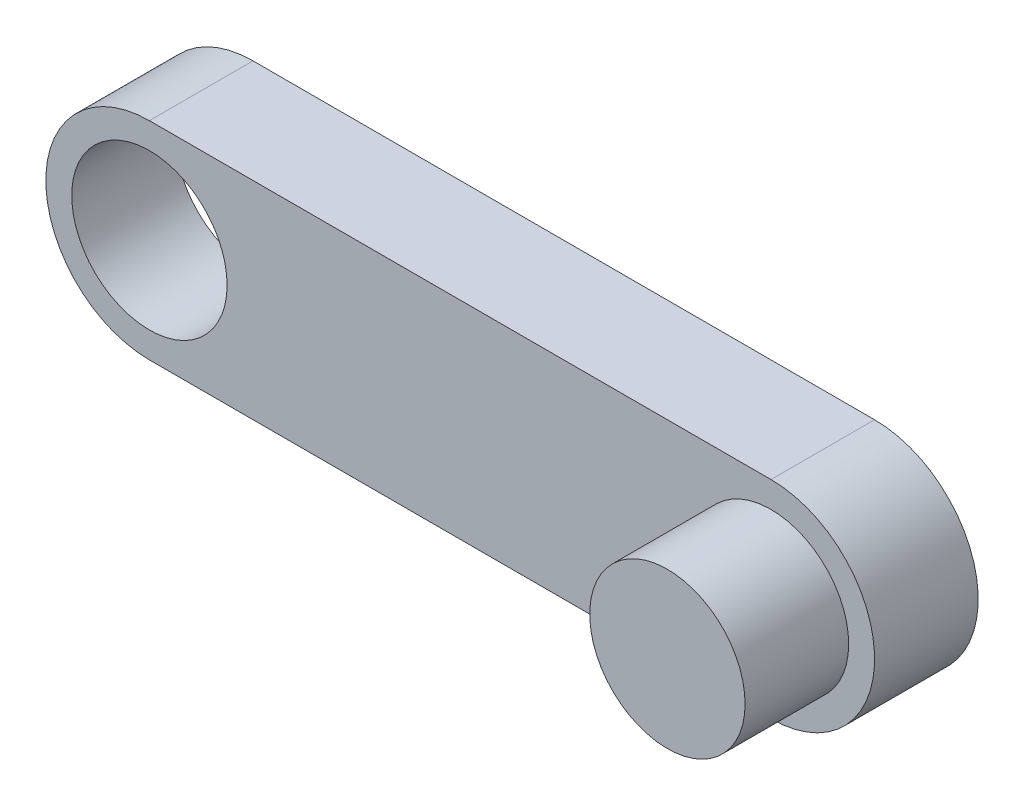
from build123d import *

# Parameters (mm, degrees)
SKETCH1_R           = 25.4
SKETCH1_W           = 152.4
SKETCH1_H           = 50.8
BOSS_EXTRUDE1_DEPTH = 25.4
SKETCH2_R           = 19.05
CUT_EXTRUDE1_DEPTH  = 108.763073453
SKETCH3_R           = 19.05
BOSS_EXTRUDE2_DEPTH = 25.4


with BuildPart() as part:
    # Sketch1 → Boss-Extrude1 (new body)
    with BuildSketch(Plane.XY):
        with Locations((-76.2, 0)):
            Circle(SKETCH1_R)
        with Locations((76.2, 0)):
            Circle(SKETCH1_R)
        Rectangle(SKETCH1_W, SKETCH1_H)
    extrude(amount=BOSS_EXTRUDE1_DEPTH)

    # Sketch2 → Cut-Extrude1 (cut, through all)
    with BuildSketch(Plane.XY.offset(25.4)):
        with Locations((-76.2, 0)):
            Circle(SKETCH2_R)
    extrude(amount=-CUT_EXTRUDE1_DEPTH, mode=Mode.SUBTRACT)

    # Sketch3 → Boss-Extrude2 (add)
    with BuildSketch(Plane.XY.offset(25.4)):
        with Locations((76.2, 0)):
            Circle(SKETCH3_R)
    extrude(amount=BOSS_EXTRUDE2_DEPTH)


solid = part.part
